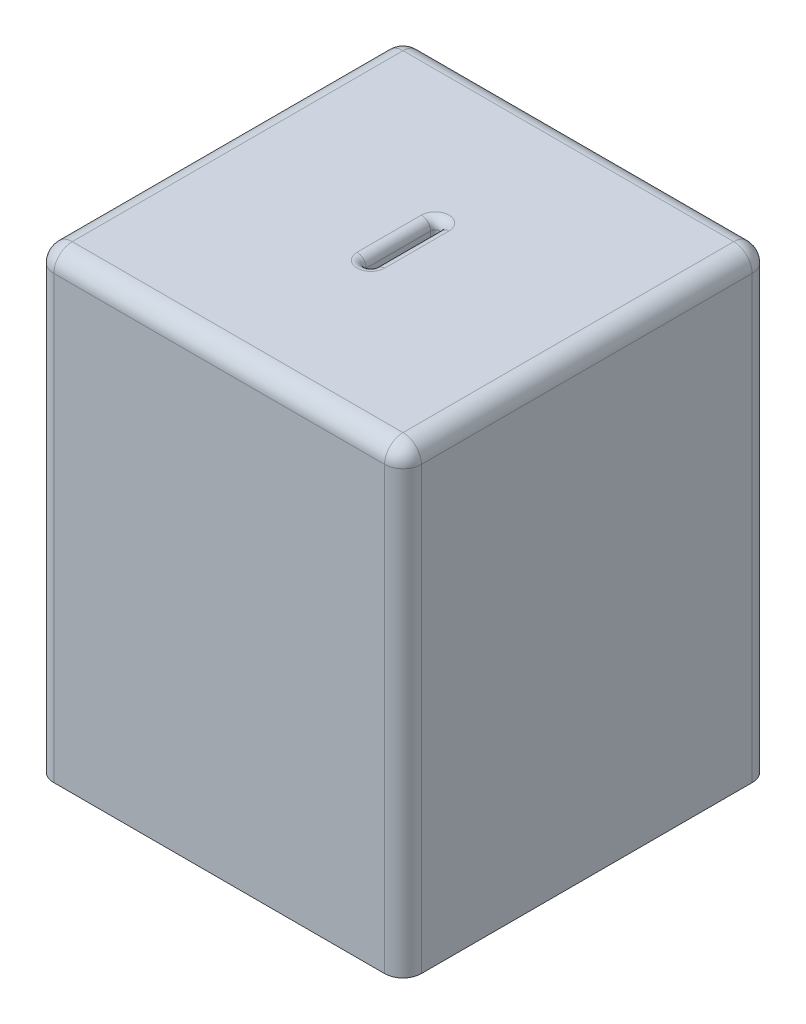
from build123d import *

# Parameters (mm, degrees)
SKETCH1_W           = 200
SKETCH1_H           = 200
BOSS_EXTRUDE1_DEPTH = 250
FILLET1_R           = 10
SHELL1_START        = -51.838440111
SHELL1_OUTLINE_W    = 230
SHELL1_OUTLINE_H    = 180
SHELL1_DEPTH        = 180
CUT_EXTRUDE1_REACH  = 305.662
FILLET2_R           = 5
CUT_EXTRUDE2_REACH  = 305.662
SKETCH3_R           = 20


# Read off the part's stored shape, not the designer's step: Shell1
with BuildPart() as part:
    # Sketch1 → Boss-Extrude1 (new body)
    with BuildSketch(Plane(origin=(0, 0, 0), x_dir=(1, 0, 0), z_dir=(0, 1, 0))):
        with Locations((38.161559889, 3.064066852)):
            Rectangle(SKETCH1_W, SKETCH1_H)
    extrude(amount=BOSS_EXTRUDE1_DEPTH)

    # Fillet1
    fillet1_edges = [part.edges().sort_by_distance(p)[0] for p in [
        (138.161559889, 250, -3.064066852),
        (38.161559889, 250, -103.064066852),
        (-61.838440111, 250, -3.064066852),
        (-61.838440111, 125, -103.064066852),
        (138.161559889, 125, -103.064066852),
        (138.161559889, 125, 96.935933148),
        (-61.838440111, 125, 96.935933148),
        (38.161559889, 250, 96.935933148),
    ]]
    fillet(fillet1_edges, radius=FILLET1_R)

    # Shell1 outline → Shell1 (cut)
    with BuildSketch(Plane.YZ.offset(SHELL1_START)):
        with Locations((125, -3.064066852)):
            Rectangle(SHELL1_OUTLINE_W, SHELL1_OUTLINE_H)
    extrude(amount=SHELL1_DEPTH, mode=Mode.SUBTRACT)

    # Sketch2 → Cut-Extrude1 (cut, up to next)
    with BuildSketch(Plane(origin=(0, 250, 0), x_dir=(1, 0, 0), z_dir=(0, 1, 0)), mode=Mode.PRIVATE) as cut_extrude1_sk1:
        with BuildLine():
            Line((40.661559889, 20.564066852), (40.661559889, -14.435933148))
            ThreePointArc((40.661559889, -14.435933148), (38.161559889, -16.935933148), (35.661559889, -14.435933148))
            Line((35.661559889, -14.435933148), (35.661559889, 20.564066852))
            ThreePointArc((35.661559889, 20.564066852), (38.161559889, 23.064066852), (40.661559889, 20.564066852))
        make_face()
    cut_extrude1_tool1 = extrude(cut_extrude1_sk1.sketch, amount=-CUT_EXTRUDE1_REACH, mode=Mode.PRIVATE) & part.part
    add(cut_extrude1_tool1.solids().sort_by_distance((38.16156, 250, -3.064067))[0], mode=Mode.SUBTRACT)

    # Fillet2
    fillet2_edges = [part.edges().sort_by_distance(p)[0] for p in [
        (38.161559889, 250, -23.064066852),
        (35.661559889, 250, -3.064066852),
        (38.161559889, 250, 16.935933148),
        (40.661559889, 250, -3.064066852),
    ]]
    fillet(fillet2_edges, radius=FILLET2_R)

    # Sketch3 → Cut-Extrude2 (cut, up to next)
    with BuildSketch(Plane(origin=(0, 0, 0), x_dir=(-1, 0, 0), z_dir=(0, -1, 0)), mode=Mode.PRIVATE) as cut_extrude2_sk1:
        with Locations(Location((-38.161559889, 3.064066852, 0), (0, 0, 90))):
            Circle(SKETCH3_R)
    cut_extrude2_tool1 = extrude(cut_extrude2_sk1.sketch, amount=-CUT_EXTRUDE2_REACH, mode=Mode.PRIVATE) & part.part
    add(cut_extrude2_tool1.solids().sort_by_distance((38.16156, 0, -3.064067))[0], mode=Mode.SUBTRACT)


solid = part.part
